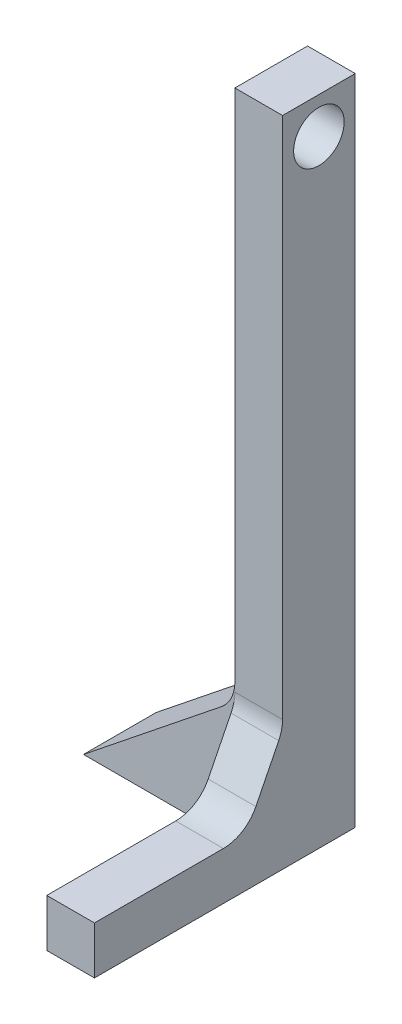
from build123d import *

# Parameters (mm, degrees)
SKETCH1_W           = 15.24
SKETCH1_H           = 136.915
BOSS_EXTRUDE1_DEPTH = 10
SKETCH2_R           = 5.3
CUT_EXTRUDE1_DEPTH  = 165.72630229
BOSS_EXTRUDE2_DEPTH = 15.24
BOSS_EXTRUDE3_DEPTH = 10
FILLET7_R           = 7.62
FILLET8_R           = 7.62


with BuildPart() as part:
    # Sketch1 → Boss-Extrude1 (new body)
    with BuildSketch(Plane(origin=(37.730745885, 0, 0), x_dir=(0, 0, -1), z_dir=(1, 0, 0))):
        with Locations((136.328078847, -11.001327465)):
            Rectangle(SKETCH1_W, SKETCH1_H)
    extrude(amount=BOSS_EXTRUDE1_DEPTH)

    # Sketch2 → Cut-Extrude1 (cut, through all)
    with BuildSketch(Plane(origin=(47.730745885, 0, 0), x_dir=(0, 0, -1), z_dir=(1, 0, 0))):
        with Locations((136.328078847, 49.836172535)):
            Circle(SKETCH2_R)
    extrude(amount=-CUT_EXTRUDE1_DEPTH, mode=Mode.SUBTRACT)

    # Sketch4 → Boss-Extrude2 (add)
    with BuildSketch(Plane(origin=(0, 0, -143.948078847), x_dir=(-1, 0, 0), z_dir=(0, 0, -1))):
        Polygon((-37.730745885, -79.458827465), (-5.980745885, -79.458827465), (-37.730745885, -54.058827465), align=None)
    extrude(amount=-BOSS_EXTRUDE2_DEPTH)

    # Sketch6 → Boss-Extrude3 (add)
    with BuildSketch(Plane(origin=(47.730745885, 0, 0), x_dir=(0, 0, -1), z_dir=(1, 0, 0))):
        Polygon((128.708078847, -79.458827465), (116.008078847, -79.458827465), (89.258078847, -79.458827465), (89.258078847, -69.458827465), (121.008078847, -69.458827465), (128.708078847, -54.058827465), align=None)
    extrude(amount=-BOSS_EXTRUDE3_DEPTH)

    # Fillet7
    # the kernel refuses this fillet: 7.62 mm, written as the material it adds along each edge
    with BuildSketch(Plane(origin=(37.730745885, -54.058827465, -143.948078847), x_dir=(-0.7808688094430346, -0.6246950475544188, 2.599749935093665e-15), z_dir=(0, 0, 1))) as fillet7_piece_1:
        with BuildLine():
            CenterArc((FILLET7_R * 0.480624847487, -FILLET7_R), FILLET7_R, 90, 51.340191746)
            Line((-FILLET7_R * 0.300243961956, -FILLET7_R * 0.375304952446), (0, 0))
            Line((0, 0), (FILLET7_R * 0.480624847487, 0))
        make_face()
    extrude(amount=15.24)
    with BuildSketch(Plane(origin=(47.730745885, -69.458827465, -121.008078847), x_dir=(-1.4253394908736166e-15, 0.8944271909999135, -0.4472135954999628), z_dir=(-1, 0, 0))) as fillet7_piece_2:
        with BuildLine():
            CenterArc((FILLET7_R * 0.61803398875, -FILLET7_R), FILLET7_R, 90, 63.434948823)
            Line((-FILLET7_R * 0.27639320225, -FILLET7_R * 0.5527864045), (0, 0))
            Line((0, 0), (FILLET7_R * 0.61803398875, 0))
        make_face()
    extrude(amount=10)

    # Fillet8
    fillet8_edges = [part.edges().sort_by_distance(p)[0] for p in [
        (42.730745885, -54.058827465, -128.708078847),
    ]]
    fillet(fillet8_edges, radius=FILLET8_R)


solid = part.part
